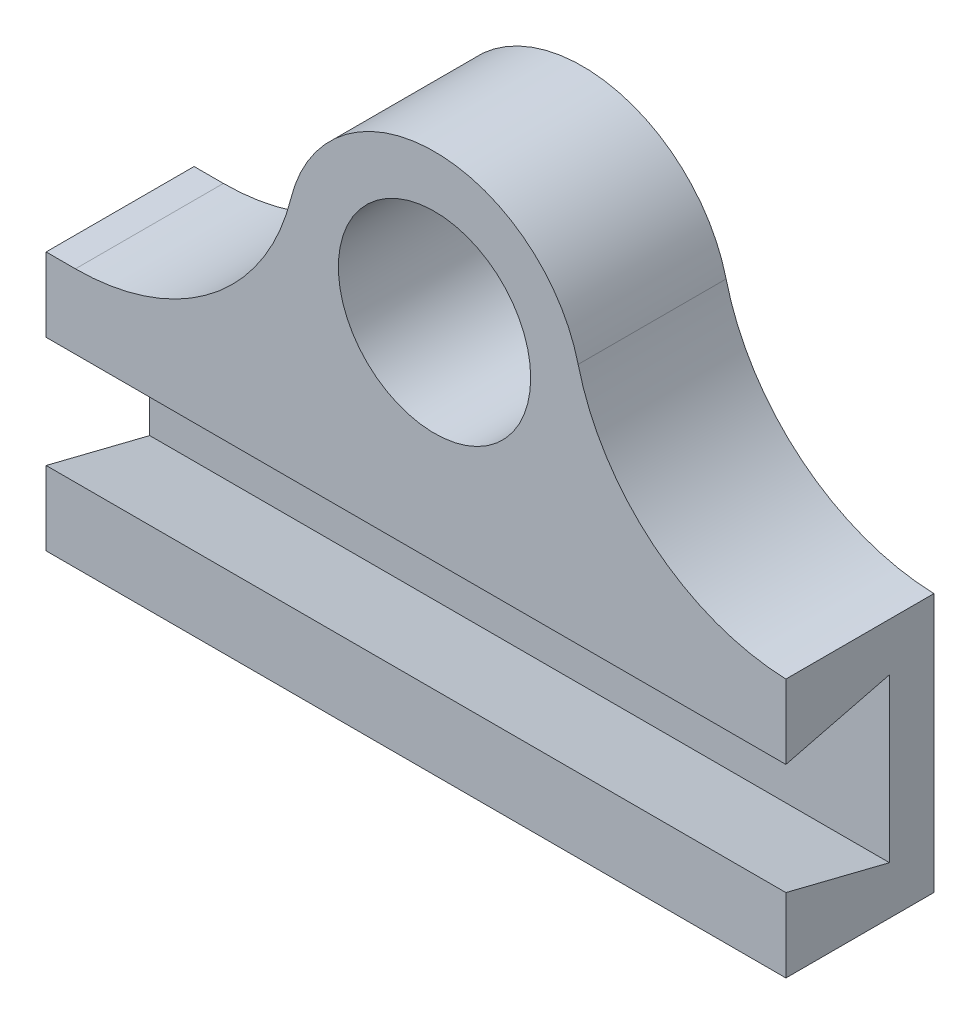
from build123d import *

# Parameters (mm, degrees)
ESQUISSE1_W             = 10
ESQUISSE1_H             = 3.5
BOSS_EXTRU_1_DEPTH      = 2
ENL_V_MAT_EXTRU_1_DEPTH = 29.00542817
BOSS_EXTRU_2_DEPTH      = 3.5
BOSS_EXTRU_3_DEPTH      = 2
ENL_V_MAT_EXTRU_2_REACH = 77.715
ESQUISSE5_R             = 1.3
CONG_1_R                = 3


with BuildPart() as part:
    # Esquisse1 → Boss.-Extru.1 (new body)
    with BuildSketch(Plane.XY):
        with Locations((-66.013415918, -24.332638037)):
            Rectangle(ESQUISSE1_W, ESQUISSE1_H)
    extrude(amount=BOSS_EXTRU_1_DEPTH)

    # Esquisse2 → Enlèv. mat.-Extru.1 (cut, through all)
    with BuildSketch(Plane.ZY.offset(71.013415918)):
        Polygon((2, -25.082638037), (2, -23.582638037), (0.6, -23.232638037), (0.6, -25.432638037), align=None)
    extrude(amount=-ENL_V_MAT_EXTRU_1_DEPTH, mode=Mode.SUBTRACT)

    # Esquisse3 → Boss.-Extru.2 (add)
    with BuildSketch(Plane.XZ.offset(26.082638037)):
        Polygon((-66.513415918, 0), (-66.213415918, -1.1), (-67.813415918, -1.1), (-67.513415918, 0), align=None)
    extrude(amount=-BOSS_EXTRU_2_DEPTH)

    # Esquisse4 → Boss.-Extru.3 (add)
    with BuildSketch(Plane.XY.offset(2)):
        with BuildLine():
            Line((-64.891636129, -22.582638037), (-66.635195707, -22.582638037))
            ThreePointArc((-66.635195707, -22.582638037), (-65.763415918, -18.782638037), (-64.891636129, -22.582638037))
        make_face()
    extrude(amount=-BOSS_EXTRU_3_DEPTH)

    # Esquisse5 → Enlèv. mat.-Extru.2 (cut, up to next)
    with BuildSketch(Plane.XY.offset(2), mode=Mode.PRIVATE) as enl_v_mat_extru_2_sk1:
        with Locations((-65.763415918, -20.782638037)):
            Circle(ESQUISSE5_R)
    enl_v_mat_extru_2_tool1 = extrude(enl_v_mat_extru_2_sk1.sketch, amount=-ENL_V_MAT_EXTRU_2_REACH, mode=Mode.PRIVATE) & part.part
    add(enl_v_mat_extru_2_tool1.solids().sort_by_distance((-65.763416, -20.782638, 2))[0], mode=Mode.SUBTRACT)

    # Congé1
    # the kernel refuses this fillet: 3 mm, written as the material it adds along each edge
    with BuildSketch(Plane(origin=(-66.635195707, -22.582638037, 2), x_dir=(-1, 0, 0), z_dir=(0, 0, -1))) as cong_1_piece_1:
        with BuildLine():
            CenterArc((3.982084651, 3), CONG_1_R, 193.886540363, 76.113459637)
            Line((1.069765987, 2.28), (1.011519614, 2.2656))
            ThreePointArc((1.011519614, 2.2656), (0.884509664, 0.975956702), (-0.026153394, 0.054))
            Line((-0.026153394, 0.054), (0, -0.06))
            Line((0, -0.06), (3.982084651, -0.06))
            Line((3.982084651, -0.06), (3.982084651, 0))
        make_face()
    extrude(amount=2)
    with BuildSketch(Plane(origin=(-64.891636129, -22.582638037, 2), x_dir=(1, 0, 0), z_dir=(0, 0, -1))) as cong_1_piece_2:
        with BuildLine():
            CenterArc((3.982532775, -2.998185933), CONG_1_R, 91.99262488, 74.142247301)
            Line((1.069945237, -2.279274373), (1.011693486, -2.264896142))
            ThreePointArc((1.011693486, -2.264896142), (0.884355653, -0.975628536), (-0.026153394, -0.054))
            Line((-0.026153394, -0.054), (0, 0.06))
            ThreePointArc((0, 0.06), (1.939110106, 0.06), (3.87613396, 0.059963719))
            Line((3.87613396, 0.059963719), (3.878220211, 0))
        make_face()
    extrude(amount=2)


solid = part.part
